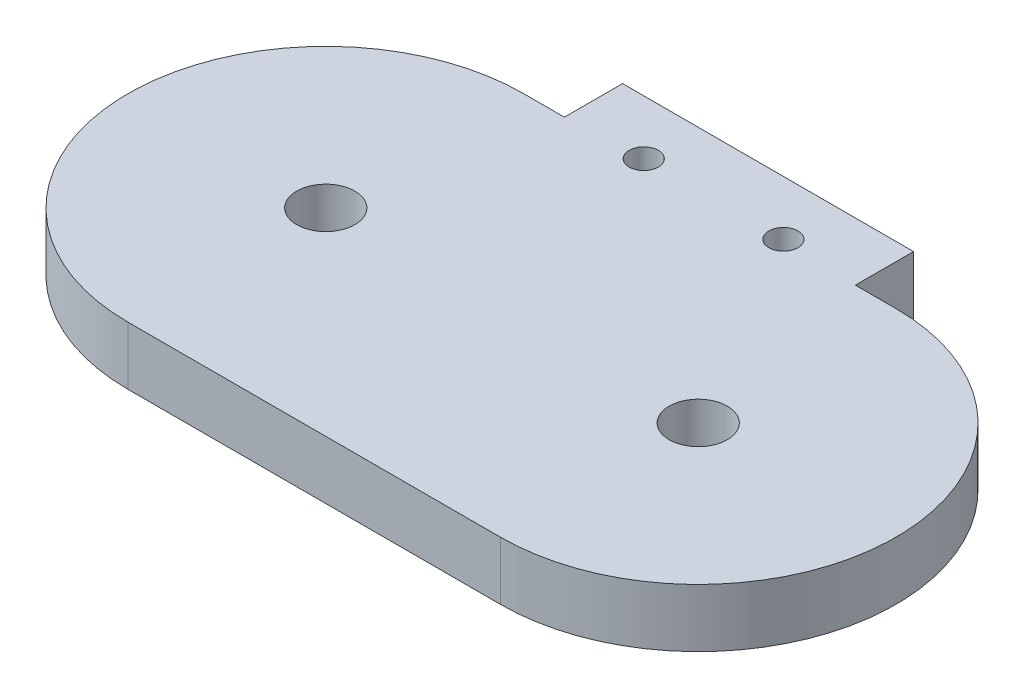
from build123d import *

# Parameters (mm, degrees)
SKETCH1_R           = 3.175
SKETCH1_R_2         = 1.5875
BOSS_EXTRUDE1_DEPTH = 6.35


with BuildPart() as part:
    # Sketch1 → Boss-Extrude1 (new body)
    with BuildSketch(Plane(origin=(0, 0, 0), x_dir=(1, 0, 0), z_dir=(0, 1, 0))):
        with BuildLine():
            ThreePointArc((-20.32, 21.59), (-41.91, 0), (-20.32, -21.59))
            Line((-20.32, -21.59), (20.32, -21.59))
            ThreePointArc((20.32, -21.59), (41.91, 0), (20.32, 21.59))
            Line((20.32, 21.59), (15.875, 21.59))
            Line((15.875, 21.59), (15.875, 27.94))
            Line((15.875, 27.94), (-15.875, 27.94))
            Line((-15.875, 27.94), (-15.875, 21.59))
            Line((-15.875, 21.59), (-20.32, 21.59))
        make_face()
        with Locations((-20.32, 0)):
            Circle(SKETCH1_R, mode=Mode.SUBTRACT)
        with Locations((20.32, 0)):
            Circle(SKETCH1_R, mode=Mode.SUBTRACT)
        with Locations((-7.62, 21.997045256)):
            Circle(SKETCH1_R_2, mode=Mode.SUBTRACT)
        with Locations((7.62, 21.997045256)):
            Circle(SKETCH1_R_2, mode=Mode.SUBTRACT)
    extrude(amount=BOSS_EXTRUDE1_DEPTH)


solid = part.part
